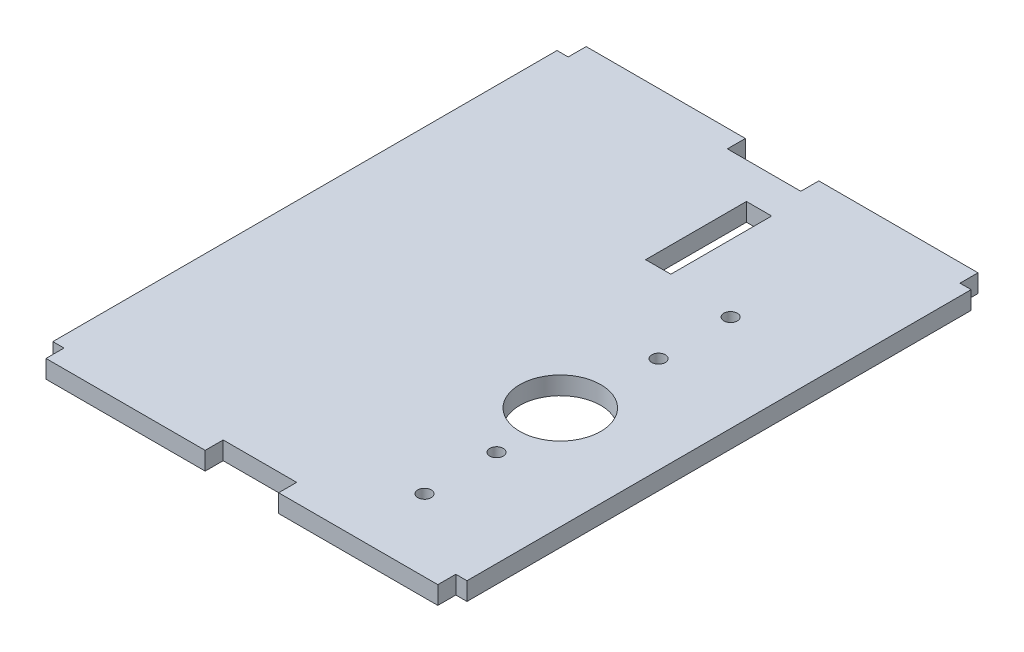
from build123d import *

# Parameters (mm, degrees)
SKETCH1_W           = 292.1
SKETCH1_H           = 355.6
SKETCH1_RX          = 28.575
SKETCH1_RY          = 28.573991153
BOSS_EXTRUDE1_DEPTH = 12.7
SKETCH2_R           = 4.7625
CUT_EXTRUDE1_DEPTH  = 12.7
SKETCH3_W           = 112.268
SKETCH3_H           = 12.7
BOSS_EXTRUDE2_DEPTH = 12.7
SKETCH5_W           = 17.78
SKETCH5_H           = 71.12
CUT_EXTRUDE2_DEPTH  = 471.243117972


with BuildPart() as part:
    # Sketch1 → Boss-Extrude1 (new body)
    with BuildSketch(Plane(origin=(0, 0, 0), x_dir=(1, 0, 0), z_dir=(0, 1, 0))):
        with Locations((146.05, 177.8)):
            Rectangle(SKETCH1_W, SKETCH1_H)
        with Locations(Location((219.512197498, 138.386094447), (0, 0, 0))):
            Ellipse(SKETCH1_RX, SKETCH1_RY, mode=Mode.SUBTRACT)
    extrude(amount=BOSS_EXTRUDE1_DEPTH)

    # Sketch2 → Cut-Extrude1 (cut)
    with BuildSketch(Plane.XZ):
        with Locations((224.028, -38.1)):
            Circle(SKETCH2_R)
        with Locations((224.028, -88.9)):
            Circle(SKETCH2_R)
        with Locations((224.028, -203.2)):
            Circle(SKETCH2_R)
        with Locations((224.028, -254)):
            Circle(SKETCH2_R)
    extrude(amount=-CUT_EXTRUDE1_DEPTH, mode=Mode.SUBTRACT)

    # Sketch3 → Boss-Extrude2 (add)
    with BuildSketch(Plane(origin=(0, 12.7, 0), x_dir=(1, 0, 0), z_dir=(0, 1, 0))):
        with Locations((64.008, 361.95)):
            Rectangle(SKETCH3_W, SKETCH3_H)
        with Locations((228.092, 361.95)):
            Rectangle(SKETCH3_W, SKETCH3_H)
        with Locations((228.092, -6.35)):
            Rectangle(SKETCH3_W, SKETCH3_H)
        with Locations((64.008, -6.35)):
            Rectangle(SKETCH3_W, SKETCH3_H)
    extrude(amount=-BOSS_EXTRUDE2_DEPTH)

    # Sketch5 → Cut-Extrude2 (cut, through all)
    with BuildSketch(Plane(origin=(0, 12.7, 0), x_dir=(1, 0, 0), z_dir=(0, 1, 0))):
        with Locations((167.894, 294.64)):
            Rectangle(SKETCH5_W, SKETCH5_H)
    extrude(amount=-CUT_EXTRUDE2_DEPTH, mode=Mode.SUBTRACT)


solid = part.part
